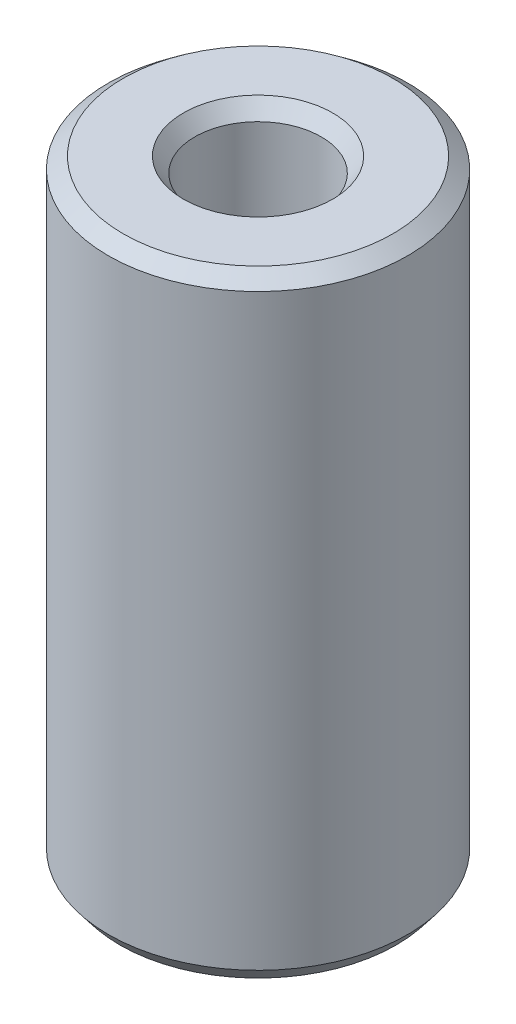
from build123d import *
from OCP.BRepFilletAPI import BRepFilletAPI_MakeChamfer

# Parameters (mm, degrees)
SKETCH1_R           = 47.5
BOSS_EXTRUDE1_DEPTH = 194.933264292
SKETCH2_R           = 20.049948416
CUT_EXTRUDE1_DEPTH  = 207.183116495
CHAMFER1_SIZE       = 3.661083539
CHAMFER1_SIZE2      = 4.726566589


with BuildPart() as part:
    # Sketch1 → Boss-Extrude1 (new body)
    with BuildSketch(Plane(origin=(0, 0, 0), x_dir=(1, 0, 0), z_dir=(0, 1, 0))):
        Circle(SKETCH1_R)
    extrude(amount=BOSS_EXTRUDE1_DEPTH)

    # Sketch2 → Cut-Extrude1 (cut, through all)
    with BuildSketch(Plane(origin=(0, 0, 0), x_dir=(1, 0, 0), z_dir=(0, 1, 0))):
        Circle(SKETCH2_R)
    extrude(amount=CUT_EXTRUDE1_DEPTH, mode=Mode.SUBTRACT)

    # Chamfer1: one chamfer whose edges measure the first distance from different faces: ONE call of the kernel's chamfer builder (chamfer() names one face for all edges)
    chamfer1_edges_1 = [part.edges().sort_by_distance(p)[0] for p in [
        (-20.049948416, 194.933264292, 0),
    ]]
    chamfer1_side_1 = [part.faces().sort_by_distance(p)[0] for p in [
        (-46.156497116, 194.933264292, 0),
    ]]
    chamfer1_edges_2 = [part.edges().sort_by_distance(p)[0] for p in [
        (-20.049948416, 0, 0),
    ]]
    chamfer1_side_2 = [part.faces().sort_by_distance(p)[0] for p in [
        (-20.049948416, 97.466632146, 0),
    ]]
    chamfer1_edges_3 = [part.edges().sort_by_distance(p)[0] for p in [
        (-47.5, 0, 0),
    ]]
    chamfer1_side_3 = [part.faces().sort_by_distance(p)[0] for p in [
        (-46.156497116, 0, 0),
    ]]
    chamfer1_edges_4 = [part.edges().sort_by_distance(p)[0] for p in [
        (-47.5, 194.933264292, 0),
    ]]
    chamfer1_side_4 = [part.faces().sort_by_distance(p)[0] for p in [
        (-47.5, 97.466632146, 0),
    ]]
    chamfer1 = BRepFilletAPI_MakeChamfer(part.part.solid().wrapped)
    for e in chamfer1_edges_1:
        chamfer1.Add(CHAMFER1_SIZE, CHAMFER1_SIZE2, e.wrapped, chamfer1_side_1[0].wrapped)  # the first distance lies on this face
    for e in chamfer1_edges_2:
        chamfer1.Add(CHAMFER1_SIZE, CHAMFER1_SIZE2, e.wrapped, chamfer1_side_2[0].wrapped)  # the first distance lies on this face
    for e in chamfer1_edges_3:
        chamfer1.Add(CHAMFER1_SIZE, CHAMFER1_SIZE2, e.wrapped, chamfer1_side_3[0].wrapped)  # the first distance lies on this face
    for e in chamfer1_edges_4:
        chamfer1.Add(CHAMFER1_SIZE, CHAMFER1_SIZE2, e.wrapped, chamfer1_side_4[0].wrapped)  # the first distance lies on this face
    add(Compound.cast(chamfer1.Shape()), mode=Mode.REPLACE)


solid = part.part
